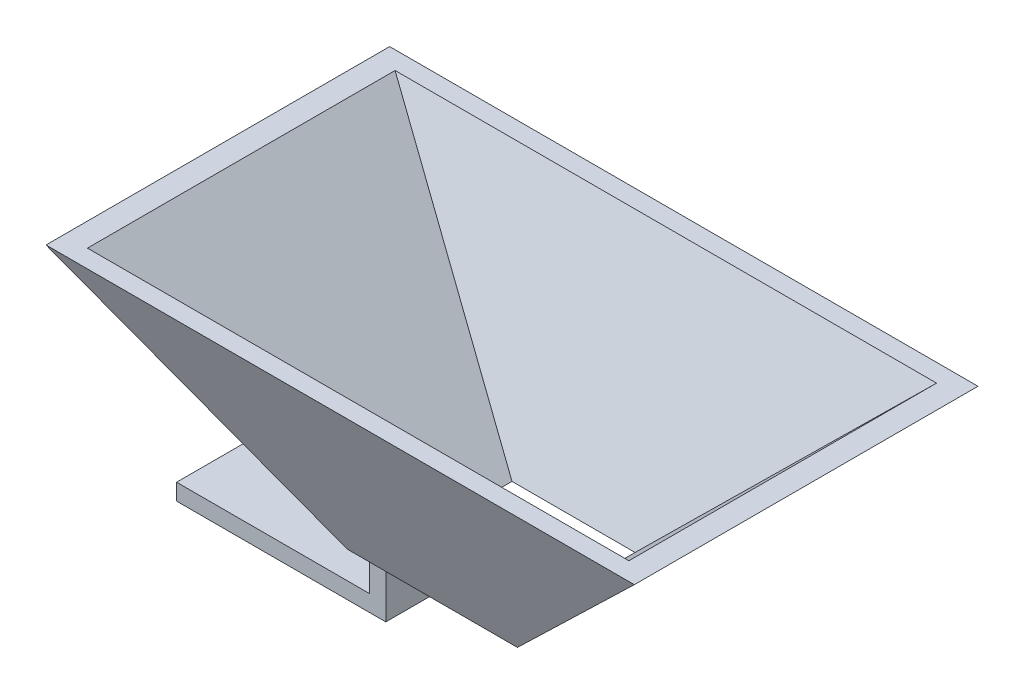
from build123d import *
from build123d.topology import SkipClean

# Parameters (mm, degrees)
SHELL1_T                 = 4
SKETCH4_W                = 50
SKETCH4_H                = 20
BOSS_EXTRUDE1_DEPTH      = 4
BOSS_EXTRUDE2_DEPTH      = 10.049697
BOSS_EXTRUDE2_DEPTH_BACK = 9.950303
SKETCH7_W                = 4
SKETCH7_H                = 20
SKETCH8_W                = 20
SKETCH8_H                = 4
BOSS_EXTRUDE3_DEPTH      = 47


with BuildPart() as part:
    # Boundary1: read off the stored shape, not the designer's step
    # Boundary1: loft between two sections, ruled curve by curve
    boundary1_from = [
        Edge.make_line((-15, 0, 15), (15, 0, 15)),
        Edge.make_line((15, 0, 15), (15, 0, -15)),
        Edge.make_line((15, 0, -15), (-15, 0, -15)),
        Edge.make_line((-15, 0, -15), (-15, 0, 15)),
    ]
    boundary1_to = [
        Edge.make_line((-66, 50, 37.5), (66, 50, 37.5)),
        Edge.make_line((66, 50, 37.5), (66, 50, -37.5)),
        Edge.make_line((66, 50, -37.5), (-66, 50, -37.5)),
        Edge.make_line((-66, 50, -37.5), (-66, 50, 37.5)),
    ]
    boundary1 = Solid(Shell([*[Face.make_surface_from_curves(boundary1_from[k], boundary1_to[k]) for k in range(4)], Face(Wire(boundary1_from)), Face(Wire(boundary1_to))]))
    add(boundary1)

    # Shell1
    shell1_openings = [part.faces().sort_by_distance(p)[0] for p in [
        (0, 0, 0),
        (0, 50, 0),
    ]]
    offset(amount=SHELL1_T, openings=shell1_openings, kind=Kind.INTERSECTION)

    # Sketch4 → Boss-Extrude1 (add)
    with BuildSketch(Plane(origin=(-10.15178535, -10.354821057, 0), x_dir=(0.7140728391445788, -0.7000714109260574, 0), z_dir=(-0.7000714109260574, -0.7140728391445788, 0))):
        with Locations((-39.791092587, 0.049697146)):
            Rectangle(SKETCH4_W, SKETCH4_H)
    extrude(amount=BOSS_EXTRUDE1_DEPTH)

    # Sketch7 → Boss-Extrude2 (add, two sides: drawn at the far end of the back side and taken through both)
    with SkipClean():  # the faces are left unmerged after this step: merging them gives an invalid solid
        with BuildSketch(Plane.XY.offset(-BOSS_EXTRUDE2_DEPTH_BACK)):
            with Locations((-22.713702827, -10)):
                Rectangle(SKETCH7_W, SKETCH7_H)
        extrude(amount=BOSS_EXTRUDE2_DEPTH + BOSS_EXTRUDE2_DEPTH_BACK)

    # Sketch8 → Boss-Extrude3 (add)
    with SkipClean():  # the faces are left unmerged after this step: merging them gives an invalid solid
        with BuildSketch(Plane.ZY.offset(24.713702827)):
            with Locations((0.049697146, -18)):
                Rectangle(SKETCH8_W, SKETCH8_H)
        extrude(amount=BOSS_EXTRUDE3_DEPTH)


solid = part.part
